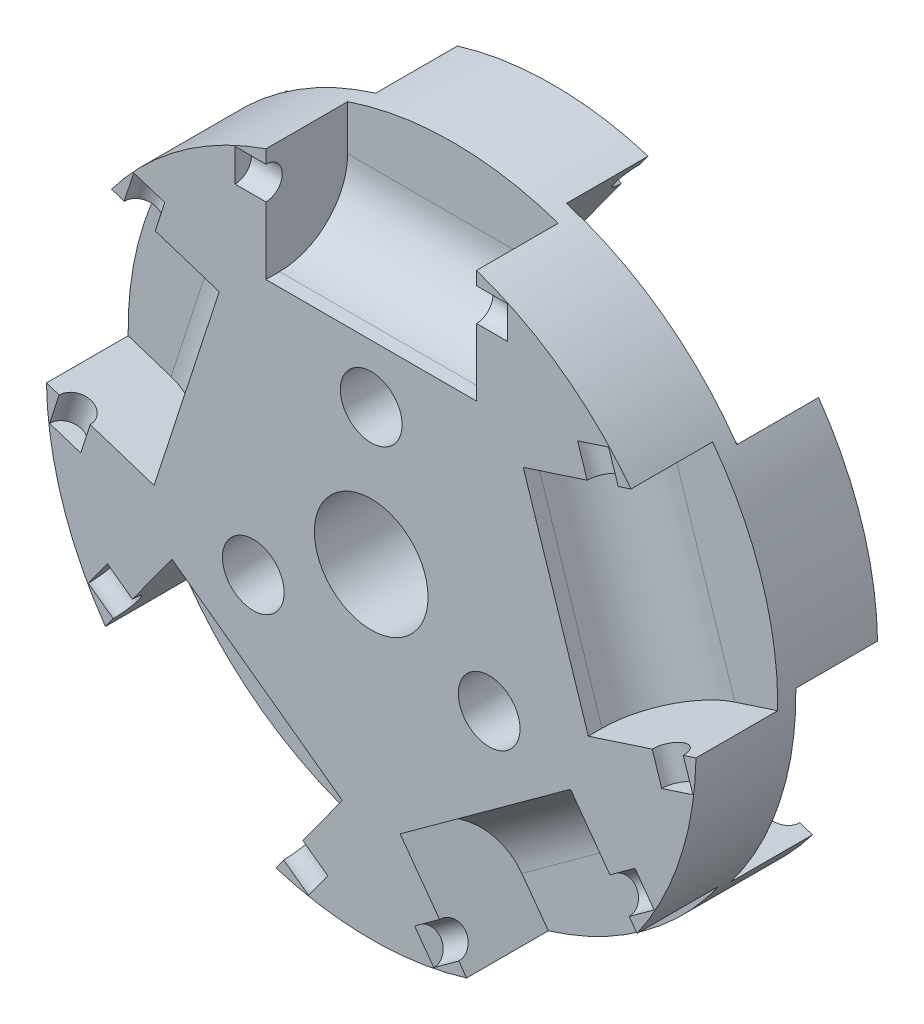
from build123d import *

# Parameters (mm, degrees)
SKETCH1_R           = 22.7203
BOSS_EXTRUDE2_DEPTH = 6.35
SKETCH2_W           = 14.732
SKETCH2_H           = 10.414
CUT_EXTRUDE2_DEPTH  = 5.715
CIRPATTERN1_COUNT   = 5
SKETCH4_R           = 1.143
CUT_EXTRUDE4_DEPTH  = 9.525
CIRPATTERN2_COUNT   = 5
SKETCH5_R           = 3.9751
CUT_EXTRUDE5_DEPTH  = 33.75281002
SKETCH6_R           = 2.159
CUT_EXTRUDE7_DEPTH  = 33.75281002
BOSS_EXTRUDE3_START = 6.35
SKETCH9_R           = 22.7203
SKETCH9_R_2         = 2.159
SKETCH9_R_3         = 3.9751
BOSS_EXTRUDE3_DEPTH = 6.35
CUT_EXTRUDE8_DEPTH  = 5.715
CIRPATTERN3_COUNT   = 5
SKETCH11_R          = 1.143
CUT_EXTRUDE9_DEPTH  = 9.525
CIRPATTERN4_COUNT   = 5
FILLET1_R           = 4.7625


with BuildPart() as part:
    # Sketch1 → Boss-Extrude2 (new body)
    with BuildSketch(Plane.XY):
        Circle(SKETCH1_R)
    extrude(amount=-BOSS_EXTRUDE2_DEPTH)

    # Sketch2 → Cut-Extrude2 (cut)
    with BuildSketch(Plane.XY):
        with Locations((0, 18.7833)):
            Rectangle(SKETCH2_W, SKETCH2_H)
    cut_extrude2 = extrude(amount=-CUT_EXTRUDE2_DEPTH, mode=Mode.SUBTRACT)

    # CirPattern1: Cut-Extrude2 ×5 about axis
    cirpattern1_axis = Axis((0, 0, 0), (0, 0, 1))
    for i in range(1, CIRPATTERN1_COUNT):
        add(cut_extrude2.rotate(cirpattern1_axis, i * 360 / CIRPATTERN1_COUNT), mode=Mode.SUBTRACT)

    # Sketch4 → Cut-Extrude4 (cut, symmetric)
    with BuildSketch(Plane(origin=(0, 0, 0), x_dir=(0, 0, -1), z_dir=(1, 0, 0))):
        with Locations((0, 19.4183)):
            Circle(SKETCH4_R)
    cut_extrude4 = extrude(amount=CUT_EXTRUDE4_DEPTH, both=True, mode=Mode.SUBTRACT)

    # CirPattern2: Cut-Extrude4 ×5 about axis
    cirpattern2_axis = Axis((0, 0, 0), (0, 0, 1))
    for i in range(1, CIRPATTERN2_COUNT):
        add(cut_extrude4.rotate(cirpattern2_axis, i * 360 / CIRPATTERN2_COUNT), mode=Mode.SUBTRACT)

    # Sketch5 → Cut-Extrude5 (cut, through all)
    with BuildSketch(Plane.XY):
        Circle(SKETCH5_R)
    extrude(amount=-CUT_EXTRUDE5_DEPTH, mode=Mode.SUBTRACT)

    # Sketch6 → Cut-Extrude7 (cut, through all)
    with BuildSketch(Plane(origin=(0, 0, -6.35), x_dir=(-1, 0, 0), z_dir=(0, 0, -1))):
        with Locations((0, 9.525)):
            Circle(SKETCH6_R)
        with Locations((8.248891971, -4.7625)):
            Circle(SKETCH6_R)
        with Locations((-8.248891971, -4.7625)):
            Circle(SKETCH6_R)
    extrude(amount=-CUT_EXTRUDE7_DEPTH, mode=Mode.SUBTRACT)

    # Sketch9 → Boss-Extrude3 (add)
    with BuildSketch(Plane(origin=(0, 0, -6.35), x_dir=(-1, 0, 0), z_dir=(0, 0, -1)).offset(BOSS_EXTRUDE3_START)):
        Circle(SKETCH9_R)
        with Locations((-8.248891971, -4.7625)):
            Circle(SKETCH9_R_2, mode=Mode.SUBTRACT)
        with Locations((8.248891971, -4.7625)):
            Circle(SKETCH9_R_2, mode=Mode.SUBTRACT)
        with Locations((0, 9.525)):
            Circle(SKETCH9_R_2, mode=Mode.SUBTRACT)
        Circle(SKETCH9_R_3, mode=Mode.SUBTRACT)
    extrude(amount=-BOSS_EXTRUDE3_DEPTH)

    # Sketch10 → Cut-Extrude8 (cut)
    with BuildSketch(Plane(origin=(0, 0, -12.7), x_dir=(-1, 0, 0), z_dir=(0, 0, -1))):
        Polygon((-2.02072974, 15.313083589), (-13.939168101, 6.653831252), (-20.060363719, 15.078934232), (-8.141925358, 23.738186569), align=None)
    cut_extrude8 = extrude(amount=-CUT_EXTRUDE8_DEPTH, mode=Mode.SUBTRACT)

    # CirPattern3: Cut-Extrude8 ×5 about axis
    cirpattern3_axis = Axis((0, 0, -12.7), (0, 0, -1))
    for i in range(1, CIRPATTERN3_COUNT):
        add(cut_extrude8.rotate(cirpattern3_axis, i * 360 / CIRPATTERN3_COUNT), mode=Mode.SUBTRACT)

    # Sketch11 → Cut-Extrude9 (cut, symmetric)
    with BuildSketch(Plane(origin=(0, 0, 0), x_dir=(0, 0, -1), z_dir=(-0.8090169943749463, 0.5877852522924747, 0))):
        with Locations((12.7, -19.4183)):
            Circle(SKETCH11_R)
    cut_extrude9 = extrude(amount=CUT_EXTRUDE9_DEPTH, both=True, mode=Mode.SUBTRACT)

    # CirPattern4: Cut-Extrude9 ×5 about axis
    cirpattern4_axis = Axis((0, 0, -12.7), (0, 0, -1))
    for i in range(1, CIRPATTERN4_COUNT):
        add(cut_extrude9.rotate(cirpattern4_axis, i * 360 / CIRPATTERN4_COUNT), mode=Mode.SUBTRACT)

    # Fillet1
    fillet1_edges = [part.edges().sort_by_distance(p)[0] for p in [
        (12.911828582, -4.195307421, -6.985),
        (0, -13.5763, -6.985),
        (-12.911828582, -4.195307421, -6.985),
        (7.979948921, 10.983457421, -6.985),
        (-7.979948921, 10.983457421, -6.985),
        (-7.979948921, -10.983457421, -5.715),
        (7.979948921, -10.983457421, -5.715),
        (12.911828582, 4.195307421, -5.715),
        (0, 13.5763, -5.715),
        (-12.911828582, 4.195307421, -5.715),
    ]]
    fillet(fillet1_edges, radius=FILLET1_R)


solid = part.part
